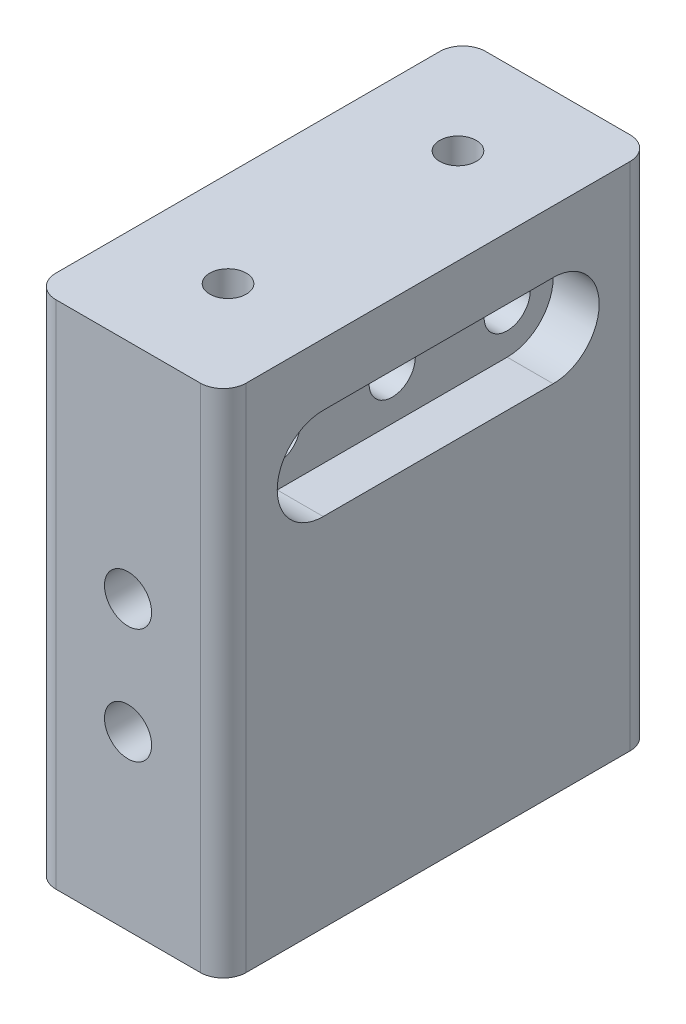
from build123d import *

# Parameters (mm, degrees)
SKETCH1_W           = 21.0312
SKETCH1_H           = 47.4853
BOSS_EXTRUDE1_DEPTH = 25.4
SKETCH2_R           = 2.6035
CUT_EXTRUDE1_DEPTH  = 55.868857829
SKETCH4_R           = 2.5527
CUT_EXTRUDE3_DEPTH  = 41.634773316
FILLET1_R           = 2.54
CUT_EXTRUDE5_DEPTH  = 5.08
BOSS_EXTRUDE2_DEPTH = 5.588
SKETCH9_R           = 2.0193
CUT_EXTRUDE6_DEPTH  = 5.08


with BuildPart() as part:
    # Sketch1 → Boss-Extrude1 (new, symmetric)
    with BuildSketch(Plane(origin=(0, 0, 0), x_dir=(1, 0, 0), z_dir=(0, 1, 0))):
        Rectangle(SKETCH1_W, SKETCH1_H)
    extrude(amount=BOSS_EXTRUDE1_DEPTH, both=True)

    # Sketch2 → Cut-Extrude1 (cut, through all)
    with BuildSketch(Plane.XY.offset(23.74265)):
        with Locations((0, -6.35)):
            Circle(SKETCH2_R)
        with Locations((0, 6.35)):
            Circle(SKETCH2_R)
    extrude(amount=-CUT_EXTRUDE1_DEPTH, mode=Mode.SUBTRACT)

    # Sketch4 → Cut-Extrude3 (cut, through all)
    with BuildSketch(Plane(origin=(10.5156, 0, 0), x_dir=(0, 0, -1), z_dir=(1, 0, 0))):
        with Locations((-12.7, 19.05)):
            Circle(SKETCH4_R)
        with Locations((12.7, 19.05)):
            Circle(SKETCH4_R)
        with Locations((0, 19.05)):
            Circle(SKETCH4_R)
    extrude(amount=-CUT_EXTRUDE3_DEPTH, mode=Mode.SUBTRACT)

    # Fillet1
    fillet1_edges = [part.edges().sort_by_distance(p)[0] for p in [
        (10.5156, 0, 23.74265),
        (-10.5156, 0, 23.74265),
        (-10.5156, 0, -23.74265),
        (10.5156, 0, -23.74265),
    ]]
    fillet(fillet1_edges, radius=FILLET1_R)

    # Sketch7 → Cut-Extrude5 (cut)
    with BuildSketch(Plane(origin=(10.5156, 0, 0), x_dir=(0, 0, -1), z_dir=(1, 0, 0))):
        with BuildLine():
            Line((-12.7, 24.13), (12.7, 24.13))
            ThreePointArc((12.7, 24.13), (17.78, 19.05), (12.7, 13.97))
            Line((12.7, 13.97), (-12.7, 13.97))
            ThreePointArc((-12.7, 13.97), (-17.78, 19.05), (-12.7, 24.13))
        make_face()
    extrude(amount=-CUT_EXTRUDE5_DEPTH, mode=Mode.SUBTRACT)

    # Sketch8 → Boss-Extrude2 (add)
    with BuildSketch(Plane(origin=(0, 25.4, 0), x_dir=(1, 0, 0), z_dir=(0, 1, 0))):
        with BuildLine():
            Line((-7.9756, -23.74265), (7.9756, -23.74265))
            ThreePointArc((7.9756, -23.74265), (9.771651224, -22.998701224), (10.5156, -21.20265))
            Line((10.5156, -21.20265), (10.5156, 21.20265))
            ThreePointArc((10.5156, 21.20265), (9.771651224, 22.998701224), (7.9756, 23.74265))
            Line((7.9756, 23.74265), (-7.9756, 23.74265))
            ThreePointArc((-7.9756, 23.74265), (-9.771651224, 22.998701224), (-10.5156, 21.20265))
            Line((-10.5156, 21.20265), (-10.5156, -21.20265))
            ThreePointArc((-10.5156, -21.20265), (-9.771651224, -22.998701224), (-7.9756, -23.74265))
        make_face()
    extrude(amount=BOSS_EXTRUDE2_DEPTH)

    # Sketch9 → Cut-Extrude6 (cut)
    with BuildSketch(Plane(origin=(0, 30.988, 0), x_dir=(1, 0, 0), z_dir=(0, 1, 0))):
        with Locations((0, 12.7)):
            Circle(SKETCH9_R)
        with Locations((0, -12.7)):
            Circle(SKETCH9_R)
    extrude(amount=-CUT_EXTRUDE6_DEPTH, mode=Mode.SUBTRACT)


solid = part.part
